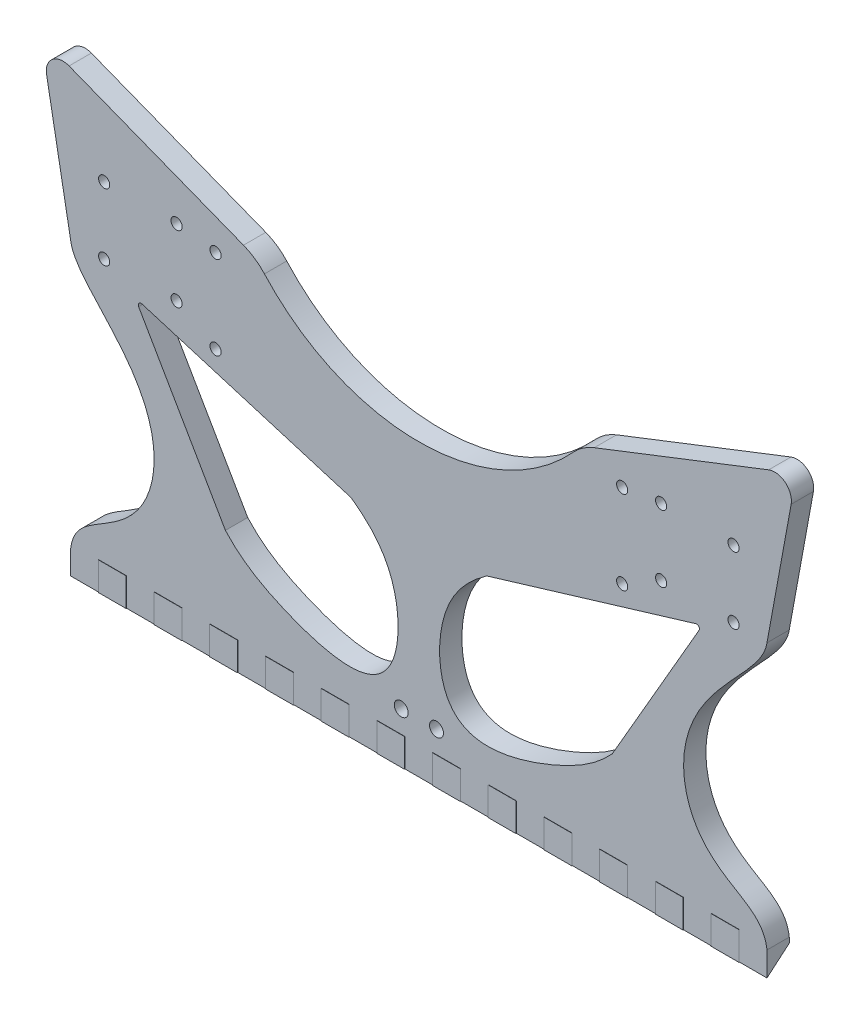
from build123d import *

# Parameters (mm, degrees)
SKETCH_1_W               = 240
SKETCH_1_H               = 120
EXTRUDE_1_DEPTH          = 8
CUT_EXTRUDE_3_DEPTH      = 240
EXTRUDE_3_DEPTH          = 240
EXTRUDE_4_DEPTH          = 2
EXTRUDE_5_DEPTH          = 2
SKETCH_10_R              = 2
CUT_EXTRUDE_4_DEPTH      = 160.937906437
CUT_EXTRUDE_START        = -8
CUT_EXTRUDE_5_DEPTH      = 8
CUT_EXTRUDE_6_DEPTH      = 253.812214384
CUT_EXTRUDE_6_DEPTH_BACK = 253.812214384
CUT_EXTRUDE_7_DEPTH      = 255.695928005
EXTRUDE_6_DEPTH          = 240
CUT_EXTRUDE_8_REACH      = 254.456
SKETCH_19_W              = 5
SKETCH_19_H              = 131.995122826
EXTRUDE_7_DEPTH          = 8
CUT_EXTRUDE_9_DEPTH      = 25000
CUT_EXTRUDE_10_OUTLINE_R = 2.5
CUT_EXTRUDE_10_DEPTH     = 8
EXTRUDE_9_DEPTH          = 8
FILLET_1_R               = 20
EXTRUDE_11_DEPTH         = 250
SKETCH_26_W              = 10
SKETCH_26_H              = 15
EXTRUDE_12_DEPTH         = 0.1
CUT_EXTRUDE_11_DEPTH     = 280.220863782


# Read off the part's stored shape, not the designer's step: 切除-拉伸5, 切除-拉伸10
with BuildPart() as part:
    # 草图1 → 凸台-拉伸1 (new body)
    with BuildSketch(Plane.XY):
        with Locations((15.314885496, 17.910305344)):
            Rectangle(SKETCH_1_W, SKETCH_1_H)
    extrude(amount=EXTRUDE_1_DEPTH)

    # 草图5 → 切除-拉伸3 (cut)
    with BuildSketch(Plane.ZY.offset(104.685114504)):
        Polygon((0, -42.089694656), (8, -42.089694656), (1.137058799, -38.127373707), (0, -37.470892503), align=None)
    extrude(amount=-CUT_EXTRUDE_3_DEPTH, mode=Mode.SUBTRACT)

    # 草图6 → 凸台-拉伸3 (add)
    with BuildSketch(Plane.ZY.offset(104.685114504)):
        Polygon((8, -42.089694656), (34.641016151, -59.78029358), (8, -36.526716392), align=None)
    extrude(amount=-EXTRUDE_3_DEPTH)

    # 草图7 → 凸台-拉伸4 (add)
    with BuildSketch(Plane.ZY.offset(104.685114504)):
        Polygon((8, 10.562283697), (24.445035201, -50.880744528), (8, -36.526716392), align=None)
    extrude(amount=-EXTRUDE_4_DEPTH)

    # 草图8 → 凸台-拉伸5 (add)
    with BuildSketch(Plane(origin=(135.314885496, 0, 0), x_dir=(0, 0, -1), z_dir=(1, 0, 0))):
        Polygon((-8, 10.562283697), (-8, -36.526716392), (-24.445035201, -50.880744528), align=None)
    extrude(amount=-EXTRUDE_5_DEPTH)

    # 草图10 → 切除-拉伸4 (cut, through all)
    with BuildSketch(Plane(origin=(0, 0, 0), x_dir=(-1, 0, 0), z_dir=(0, 0, -1))):
        with Locations((-88.314885496, 72.410305344)):
            Circle(SKETCH_10_R)
        with Locations((-88.314885496, 42.410305344)):
            Circle(SKETCH_10_R)
        with Locations(Location((57.685114504, 42.410305344, 0), (0, 0, 180))):
            Circle(SKETCH_10_R)
        with Locations(Location((57.685114504, 72.410305344, 0), (0, 0, 180))):
            Circle(SKETCH_10_R)
        with Locations((97.685114504, 74.410305344)):
            Circle(SKETCH_10_R)
        with Locations((97.685114504, 50.410305344)):
            Circle(SKETCH_10_R)
        with Locations((71.685114504, 74.410305344)):
            Circle(SKETCH_10_R)
        with Locations((71.685114504, 50.410305344)):
            Circle(SKETCH_10_R)
        with Locations(Location((-102.314885496, 50.410305344, 0), (0, 0, 180))):
            Circle(SKETCH_10_R)
        with Locations(Location((-128.314885496, 50.410305344, 0), (0, 0, 180))):
            Circle(SKETCH_10_R)
        with Locations(Location((-128.314885496, 74.410305344, 0), (0, 0, 180))):
            Circle(SKETCH_10_R)
        with Locations(Location((-102.314885496, 74.410305344, 0), (0, 0, 180))):
            Circle(SKETCH_10_R)
    extrude(amount=-CUT_EXTRUDE_4_DEPTH, mode=Mode.SUBTRACT)

    # 切除-拉伸5 outline → 切除-拉伸5 (cut)
    with BuildSketch(Plane.XY.offset(8).offset(CUT_EXTRUDE_START)):
        with BuildLine():
            Line((-85.305572399, 41.762915626), (-54.149293781, -12.223394737))
            add(Edge.make_bspline(
                [(-54.149293781, -12.223394737), (-42.947902037, -24.544925656), (-30.906405911, -28.185377973), (-18.024805405, -30.145621528), (17.539613385, -54.788683367), (6.898291227, -20.904473339), (10.818778338, -6.902733658), (10.818778338, 6.538936436), (-9.063692009, 20.540676117)],
                knots=[0, 0, 0, 0, 0, 0, 0, 0, 0, 1, 1, 1, 1, 1, 1, 1, 1, 1], degree=8))
            Line((-9.063692009, 20.540676117), (-84.150317121, 43.220048807))
            ThreePointArc((-84.150317121, 43.220048807), (-85.223061497, 42.884024389), (-85.305572399, 41.762915626))
        make_face()
        with BuildLine():
            Line((114.780088113, 43.220048807), (39.693463001, 20.540676117))
            add(Edge.make_bspline(
                [(39.693463001, 20.540676117), (19.810992654, 6.538936436), (19.810992654, -6.902733658), (23.731479765, -20.904473339), (13.090157607, -54.788683367), (48.654576397, -30.145621528), (61.536176903, -28.185377973), (73.577673029, -24.544925656), (84.779064774, -12.223394737)],
                knots=[0, 0, 0, 0, 0, 0, 0, 0, 0, 1, 1, 1, 1, 1, 1, 1, 1, 1], degree=8))
            Line((84.779064774, -12.223394737), (115.935343391, 41.762915626))
            ThreePointArc((115.935343391, 41.762915626), (115.85283249, 42.884024389), (114.780088113, 43.220048807))
        make_face()
        with BuildLine():
            Line((73.645432244, 77.910305344), (-43.015661252, 77.910305344))
            ThreePointArc((-43.015661252, 77.910305344), (15.314885496, 50.054205438), (73.645432244, 77.910305344))
        make_face()
    extrude(amount=CUT_EXTRUDE_5_DEPTH, mode=Mode.SUBTRACT)

    # 草图14 → 切除-拉伸6 (cut, two sides: drawn at the far end of the back side and taken through both)
    with BuildSketch(Plane(origin=(-102.685114504, 0, 0), x_dir=(0, 0, -1), z_dir=(1, 0, 0)).offset(-CUT_EXTRUDE_6_DEPTH_BACK)):
        Polygon((-8, -36.526716392), (-8, 10.562283697), (-24.445035201, -50.880744528), align=None)
    extrude(amount=CUT_EXTRUDE_6_DEPTH + CUT_EXTRUDE_6_DEPTH_BACK, mode=Mode.SUBTRACT)

    # 草图15 → 切除-拉伸7 (cut, through all)
    with BuildSketch(Plane(origin=(135.314885496, 0, 0), x_dir=(0, 0, -1), z_dir=(1, 0, 0))):
        Polygon((-8, -36.526716392), (-8, -49.78029358), (-41.869464541, -71.644239127), (-41.869464541, -31.236191865), align=None)
    extrude(amount=-CUT_EXTRUDE_7_DEPTH, mode=Mode.SUBTRACT)

    # 草图17 → 凸台-拉伸6 (add)
    with BuildSketch(Plane.ZY.offset(104.685114504)):
        Polygon((8, -42.089694656), (0, -37.470892503), (0, -57.621161091), (8, -62.239963244), align=None)
    extrude(amount=-EXTRUDE_6_DEPTH)

    # 草图18 → 切除-拉伸8 (cut, up to next)
    with BuildSketch(Plane.ZY.offset(104.685114504), mode=Mode.PRIVATE) as cut_extrude_8_sk1:
        Polygon((8, -54.084817482), (0, -47.372020433), (0, -57.621161091), (8, -62.239963244), align=None)
    cut_extrude_8_tool1 = extrude(cut_extrude_8_sk1.sketch, amount=-CUT_EXTRUDE_8_REACH, mode=Mode.PRIVATE) & part.part
    add(cut_extrude_8_tool1.solids().sort_by_distance((-104.685115, -55.22205, 3.848297))[0], mode=Mode.SUBTRACT)

    # 草图19 → 凸台-拉伸7 (add)
    with BuildSketch(Plane.XY):
        with Locations((-107.185114504, 11.912743931)):
            Rectangle(SKETCH_19_W, SKETCH_19_H)
        with Locations((137.814885496, 11.912743931)):
            Rectangle(SKETCH_19_W, SKETCH_19_H)
    extrude(amount=EXTRUDE_7_DEPTH)

    # 草图20 → 切除-拉伸9 (cut, symmetric)
    with BuildSketch(Plane(origin=(-104.685114504, 0, 0), x_dir=(0, 0, -1), z_dir=(1, 0, 0))):
        Polygon((0, -47.372020433), (-8, -54.084817482), (0, -54.084817482), align=None)
    extrude(amount=CUT_EXTRUDE_9_DEPTH, both=True, mode=Mode.SUBTRACT)

    # 切除-拉伸10 outline → 切除-拉伸10 (cut)
    with BuildSketch(Plane.XY.offset(8).offset(CUT_EXTRUDE_START)):
        with BuildLine():
            Line((140.314885496, -45.465697905), (140.314885496, 50.054205438))
            add(Edge.make_bspline(
                [(140.314885496, 50.054205438), (137.158486233, 30.091614758), (88.199951512, 16.126556544), (112.176664555, -11.734503746), (106.252853678, -38.244537039), (137.741665906, -24.260832479), (140.314885496, -45.465697905)],
                knots=[0, 0, 0, 0, 0, 0, 0, 1, 1, 1, 1, 1, 1, 1], degree=6))
        make_face()
        with BuildLine():
            Line((-109.685114504, 50.054205438), (-109.685114504, -45.465697905))
            add(Edge.make_bspline(
                [(-109.685114504, -45.465697905), (-107.111894913, -24.260832479), (-75.623082686, -38.244537039), (-81.546893563, -11.734503746), (-57.57018052, 16.126556544), (-106.528715241, 30.091614758), (-109.685114504, 50.054205438)],
                knots=[0, 0, 0, 0, 0, 0, 0, 1, 1, 1, 1, 1, 1, 1], degree=6))
        make_face()
        with Locations((8.984830356, -36.133723352)):
            Circle(CUT_EXTRUDE_10_OUTLINE_R)
        with Locations((21.644940637, -36.133723352)):
            Circle(CUT_EXTRUDE_10_OUTLINE_R)
    extrude(amount=CUT_EXTRUDE_10_DEPTH, mode=Mode.SUBTRACT)

    # 草图23 → 凸台-拉伸9 (add)
    with BuildSketch(Plane.XY.offset(8)):
        with BuildLine():
            Line((-109.685114504, 77.910305344), (-43.015661252, 77.910305344))
            Line((-43.015661252, 77.910305344), (-110.286718721, 104.141059297))
            ThreePointArc((-110.286718721, 104.141059297), (-116.285944727, 103.178230136), (-118.368287428, 97.470200569))
            Line((-118.368287428, 97.470200569), (-109.685114504, 50.054205438))
            Line((-109.685114504, 50.054205438), (-109.685114504, 77.910305344))
        make_face()
        with BuildLine():
            Line((148.998058421, 97.470200569), (140.314885496, 50.054205438))
            Line((140.314885496, 50.054205438), (140.314885496, 77.910305344))
            Line((140.314885496, 77.910305344), (73.645432244, 77.910305344))
            Line((73.645432244, 77.910305344), (140.916489713, 104.141059297))
            ThreePointArc((140.916489713, 104.141059297), (146.915715719, 103.178230136), (148.998058421, 97.470200569))
        make_face()
    extrude(amount=-EXTRUDE_9_DEPTH)

    # 圆角1
    fillet_1_edges = [part.edges().sort_by_distance(p)[0] for p in [
        (73.645432244, 77.910305344, 4),
        (-43.015661252, 77.910305344, 4),
    ]]
    fillet(fillet_1_edges, radius=FILLET_1_R)

    # 草图25 → 凸台-拉伸11 (add)
    with BuildSketch(Plane.ZY.offset(109.685114504)):
        Polygon((0, -47.372020433), (8, -54.084817482), (8, -59.084817482), (0, -52.372020433), align=None)
    extrude(amount=-EXTRUDE_11_DEPTH)

    # 草图26 → 凸台-拉伸12 (add)
    with BuildSketch(Plane.XY.offset(8)):
        with Locations((-94.685114504, -51.584817482)):
            Rectangle(SKETCH_26_W, SKETCH_26_H)
        with Locations((-74.685114504, -51.584817482)):
            Rectangle(SKETCH_26_W, SKETCH_26_H)
        with Locations((-54.685114504, -51.584817482)):
            Rectangle(SKETCH_26_W, SKETCH_26_H)
        with Locations((-34.685114504, -51.584817482)):
            Rectangle(SKETCH_26_W, SKETCH_26_H)
        with Locations((-14.685114504, -51.584817482)):
            Rectangle(SKETCH_26_W, SKETCH_26_H)
        with Locations((5.314885496, -51.584817482)):
            Rectangle(SKETCH_26_W, SKETCH_26_H)
        with Locations((25.314885496, -51.584817482)):
            Rectangle(SKETCH_26_W, SKETCH_26_H)
        with Locations((45.314885496, -51.584817482)):
            Rectangle(SKETCH_26_W, SKETCH_26_H)
        with Locations((65.314885496, -51.584817482)):
            Rectangle(SKETCH_26_W, SKETCH_26_H)
        with Locations((85.314885496, -51.584817482)):
            Rectangle(SKETCH_26_W, SKETCH_26_H)
        with Locations((105.314885496, -51.584817482)):
            Rectangle(SKETCH_26_W, SKETCH_26_H)
        with Locations((125.314885496, -51.584817482)):
            Rectangle(SKETCH_26_W, SKETCH_26_H)
    extrude(amount=EXTRUDE_12_DEPTH)

    # 草图27 → 切除-拉伸11 (cut, through all)
    with BuildSketch(Plane.ZY.offset(109.685114504)):
        Polygon((8, -54.182166182), (0, -47.372020433), (0, -52.372020433), (8, -59.084817482), (8.781870659, -59.891234403), (8.781870659, -54.740884863), align=None)
    extrude(amount=-CUT_EXTRUDE_11_DEPTH, mode=Mode.SUBTRACT)


solid = part.part
